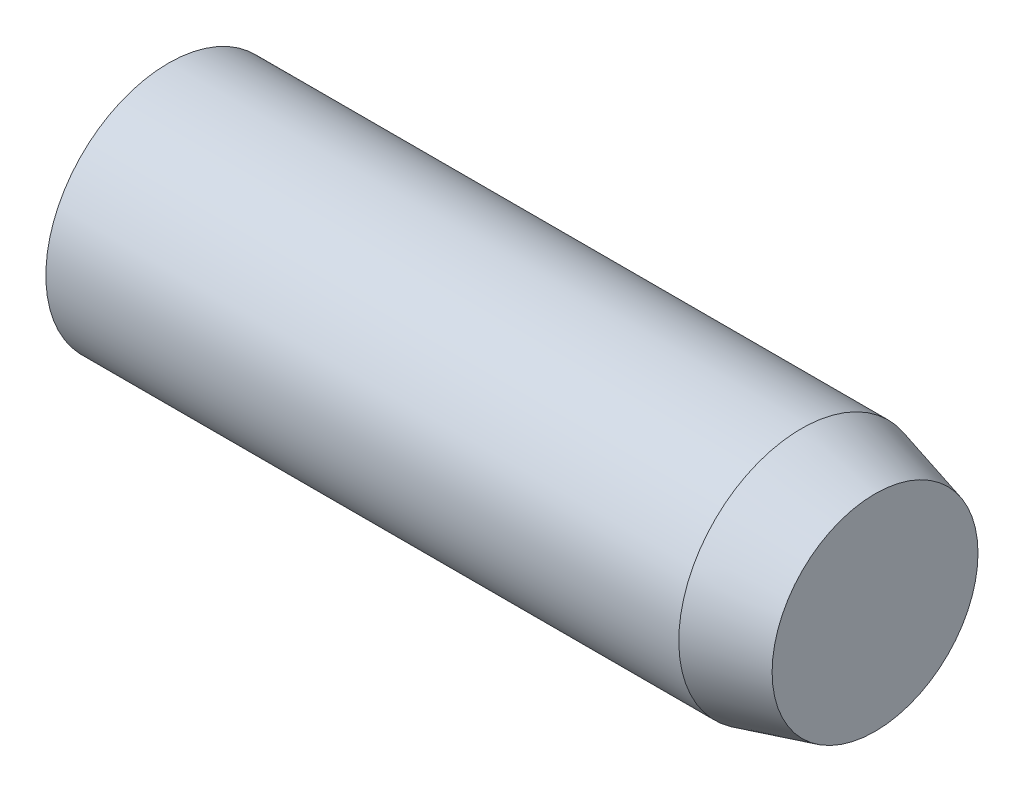
from build123d import *


with BuildPart() as part:
    # BodySke → Body (revolve)
    with BuildSketch(Plane.XY):
        with BuildLine():
            Line((27, 5), (30, 4.196152423))
            Line((30, 4.196152423), (30, 0))
            Line((30, 0), (0, 0))
            ThreePointArc((0, 0), (0.30419989, 2.570992026), (1.2, 5))
            Line((1.2, 5), (27, 5))
        make_face()
    revolve(axis=Axis((0, 0, 0), (1, 0, 0)))


solid = part.part
